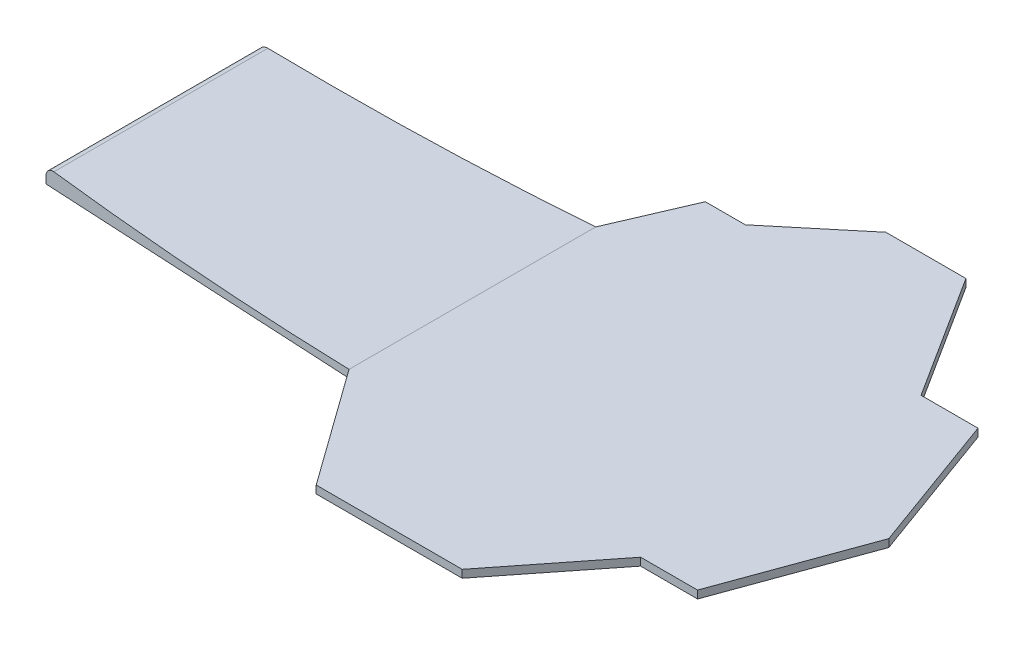
from build123d import *

# Parameters (mm, degrees)
EXTRUDE_1_DEPTH          = 2
EXTRUDE_2_DEPTH          = 2
CUT_EXTRUDE_3_DEPTH      = 202.869395429
CUT_EXTRUDE_3_DEPTH_BACK = 202.869395429
FILLET_1_R               = 2


with BuildPart() as part:
    # 草图2 → 凸台-拉伸1 (new body)
    with BuildSketch(Plane(origin=(0, 0, 0), x_dir=(1, 0, 0), z_dir=(0, 1, 0))):
        Polygon((141.821582241, 68.082690978), (121.161879345, 68.082690978), (101.35099463, 51.608897425), (91.039832206, 51.608897425), (82.527346571, 31.825074964), (0, 27.5), (0, -27.5), (82.527346571, -31.825074964), (104.14664553, -61.917309022), (141.821582241, -61.917309022), (162.133732132, -36.18552755), (176.829545061, -36.18552755), (190, 0), (176.829545061, 36.18552755), (162.133732132, 36.18552755), align=None)
    extrude(amount=EXTRUDE_1_DEPTH)

    # 草图6 → 凸台-拉伸2 (add)
    with BuildSketch(Plane(origin=(0, 2, 0), x_dir=(1, 0, 0), z_dir=(0, 1, 0))):
        Polygon((82.527346571, 31.825074964), (82.527346571, -31.825074964), (0, -27.5), (0, 27.5), align=None)
    extrude(amount=EXTRUDE_2_DEPTH)

    # 草图7 → 切除-拉伸3 (cut, two sides: drawn at the far end of the back side and taken through both)
    with BuildSketch(Plane.XY.offset(-CUT_EXTRUDE_3_DEPTH_BACK)):
        with BuildLine():
            Line((82.527346571, 2), (82.527346571, 30.740821148))
            Line((82.527346571, 30.740821148), (0, 4))
            add(Edge.make_bspline(
                [(82.527346571, 2), (41.215261335, 1.001172546), (0, 4)],
                knots=[0, 0, 0, 1, 1, 1], degree=2))
        make_face()
    extrude(amount=CUT_EXTRUDE_3_DEPTH + CUT_EXTRUDE_3_DEPTH_BACK, mode=Mode.SUBTRACT)

    # 圆角1
    fillet_1_edges = [part.edges().sort_by_distance(p)[0] for p in [
        (0, 4, 13.75),
    ]]
    fillet(fillet_1_edges, radius=FILLET_1_R)


solid = part.part
